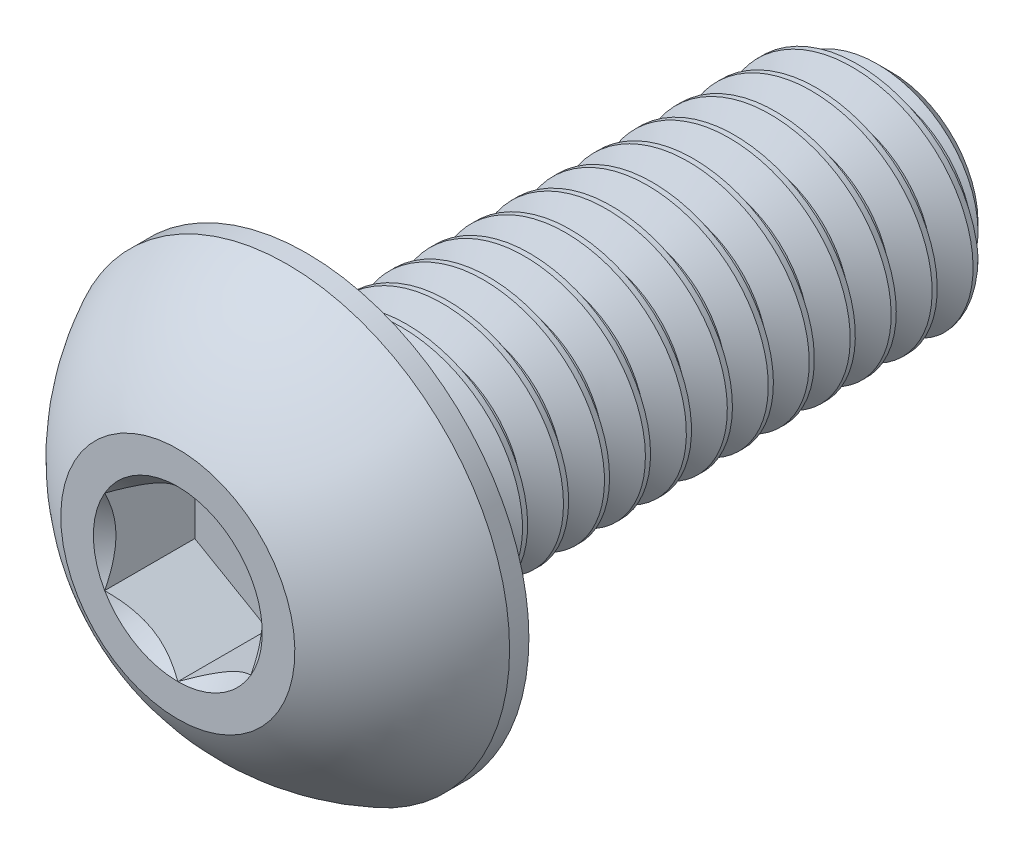
from build123d import *

# Parameters (mm, degrees)
CUT_EXTRUDE2_DEPTH = 1.54
CUT_SWEEP2_PITCH   = 0.7
CUT_SWEEP2_TO      = 10


with BuildPart() as part:
    # Sketch10 → Revolve3 (revolve)
    with BuildSketch(Plane(origin=(0, 0, 0), x_dir=(0, 0, -1), z_dir=(1, 0, 0)), mode=Mode.PRIVATE) as revolve3_sk:
        Polygon((11.675, 2), (12.2, 1.475), (12.2, 0), (2.2, 0), (2.2, 2), align=None)
    revolve(revolve3_sk.sketch.rotate(Axis((0, 0, 0), (0, 0, -1)), 90), axis=Axis((0, 0, 0), (0, 0, -1)))

    # Sketch7 → Revolve2 (revolve)
    with BuildSketch(Plane(origin=(0, 0, 0), x_dir=(0, 0, -1), z_dir=(1, 0, 0)), mode=Mode.PRIVATE) as revolve2_sk:
        with BuildLine():
            Line((1.87, 3.8), (2.2, 3.8))
            Line((2.2, 3.8), (2.2, 0))
            Line((2.2, 0), (0, 0))
            Line((0, 0), (0, 2))
            ThreePointArc((0, 2), (0.793500147, 3.047002626), (1.87, 3.8))
        make_face()
    revolve(revolve2_sk.sketch.rotate(Axis((0, 0, 0), (0, 0, -1)), 180), axis=Axis((0, 0, 0), (0, 0, -1)))

    # Sketch5 → Cut-Extrude2 (cut)
    with BuildSketch(Plane.XY):
        Polygon((1.25, -0.721687836), (1.25, 0.721687836), (0, 1.443375673), (-1.25, 0.721687836), (-1.25, -0.721687836), (0, -1.443375673), align=None)
    extrude(amount=-CUT_EXTRUDE2_DEPTH, mode=Mode.SUBTRACT)

    # Cut-Extrude3 cone 1 section (through the dimple's axis) → Cut-Extrude3 (revolve, cut)
    with BuildSketch(Plane(origin=(0, 0, 0), x_dir=(0, -1, 0), z_dir=(1, 0, 0))):
        Polygon((0, 0), (1.443375673, 0), (0, 1.443375673), align=None)
    revolve(axis=Axis((0, 0, 0), (0, 0, -1)), mode=Mode.SUBTRACT)


with BuildPart() as body_2:
    # Split1: read off the stored shape, not the designer's step
    # Split1: the piece on the far side of the plane
    add(part.part)
    split(bisect_by=Plane.XY.offset(-2.2), keep=Keep.BOTTOM)

    # Cut-Sweep2: arcs per turn and ends read off the stored shape
    # Cut-Sweep2: the profile of Sketch12 screwed along a right-hand helix through 19 turns, 6 arcs to a turn; built about Z, then put on its axis
    cut_sweep2_z = Axis((0, 0, 0), (0, 0, 1))
    cut_sweep2_corners = [(1.545336663, 0, -0.2625), (1.545336663, 0, -0.35), (2.037888611, 0, -0.634375), (2.037888611, 0, 0.021875)]
    with BuildLine(mode=Mode.PRIVATE) as cut_sweep2_profile:
        Line(cut_sweep2_corners[0], cut_sweep2_corners[1])
        Line(cut_sweep2_corners[1], cut_sweep2_corners[2])
        Line(cut_sweep2_corners[2], cut_sweep2_corners[3])
        Line(cut_sweep2_corners[3], cut_sweep2_corners[0])
    cut_sweep2_cap = Face(cut_sweep2_profile.wire())
    cut_sweep2_turn_angles = [0, 30, 60, 90, 120, 150, 180, 210, 240, 270, 300, 330, 360]
    cut_sweep2_turn_weights = [1, 0.8660254037844387, 1, 0.8660254037844387, 1, 0.8660254037844387, 1, 0.8660254037844387, 1, 0.8660254037844387, 1, 0.8660254037844387, 1]
    cut_sweep2_turn_rails = [Edge.make_bspline([Vector(p[0], p[1], 0).rotate(cut_sweep2_z, cut_sweep2_turn_angles[k]) / cut_sweep2_turn_weights[k] + Vector(0, 0, p[2] + CUT_SWEEP2_PITCH * cut_sweep2_turn_angles[k] / 360) for k in range(13)], [0, 0, 0, 1, 1, 2, 2, 3, 3, 4, 4, 5, 5, 6, 6, 6], 2, cut_sweep2_turn_weights) for p in cut_sweep2_corners]
    cut_sweep2_turn_sides = [Face.make_surface_from_curves(cut_sweep2_turn_rails[p[0]], cut_sweep2_turn_rails[p[1]]) for p in [(0, 1), (1, 2), (2, 3), (3, 0)]]
    cut_sweep2 = Plane(origin=(0, 0, -12.2), x_dir=(0, 1, 0), z_dir=(0, 0, 1)) * split(Solid(Shell([*[p.moved(Location((0, 0, CUT_SWEEP2_PITCH * i))) for i in range(19) for p in cut_sweep2_turn_sides], cut_sweep2_cap, cut_sweep2_cap.rotate(cut_sweep2_z, 6840).moved(Location((0, 0, CUT_SWEEP2_PITCH * 6840 / 360)))])), bisect_by=Plane.XY.offset(CUT_SWEEP2_TO), keep=Keep.BOTTOM, mode=Mode.PRIVATE)
    add(cut_sweep2, mode=Mode.SUBTRACT)


with BuildPart() as part_1:
    add(part.part)

    # Split1
    split(bisect_by=Plane.XY.offset(-2.2), keep=Keep.TOP)

    add(body_2.part)  # Boss-Extrude1 merges body 2
    # Boss-Extrude1 cone 1 section (through the dimple's axis) → Boss-Extrude1 (revolve)
    with BuildSketch(Plane(origin=(0, 0, -2.2), x_dir=(0, -1, 0), z_dir=(1, 0, 0))):
        Polygon((0, 0), (2, 0), (0, 2), align=None)
    revolve(axis=Axis((0, 0, -2.2), (0, 0, -1)))


solid = part_1.part
